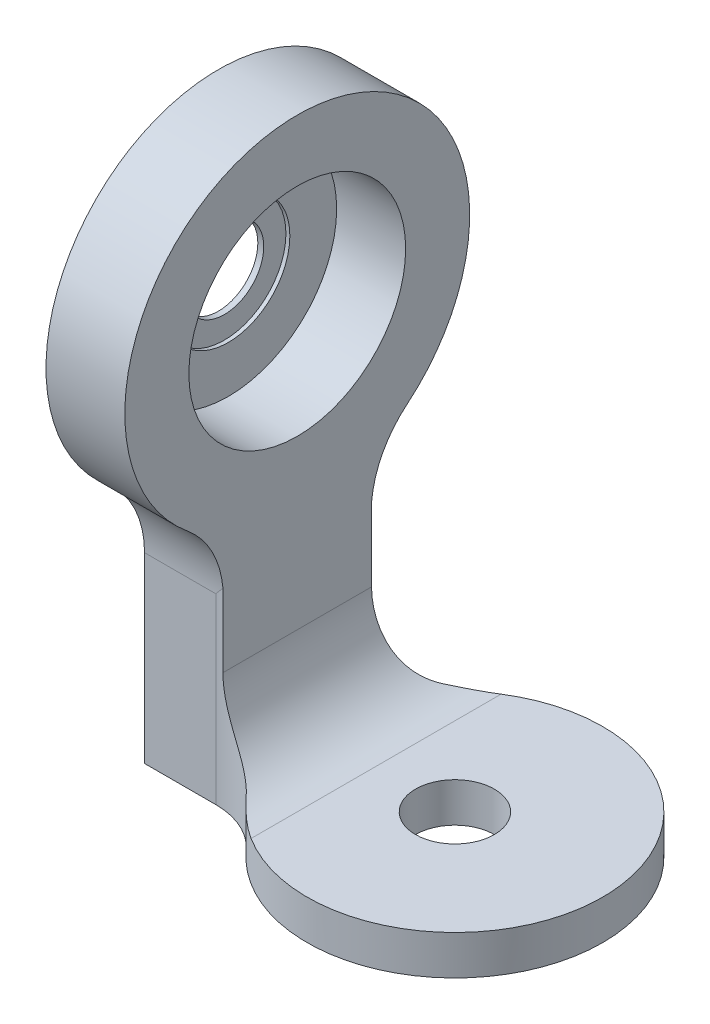
from build123d import *

# Parameters (mm, degrees)
EXTRUDE_1_DEPTH     = 4
SKETCH_4_R          = 17.5
EXTRUDE_2_DEPTH     = 8
SKETCH_3_R          = 11
CUT_EXTRUDE_1_DEPTH = 7
FILLET_5_R          = 7.5
FILLET_6_R          = 10
FILLET_7_R          = 8
SKETCH_5_R          = 4
CUT_EXTRUDE_2_DEPTH = 71.900963896
SKETCH_6_R          = 6.25
CUT_EXTRUDE_3_DEPTH = 0.4


with BuildPart() as part:
    # 草圖1 → 填料-伸長1 (new body)
    with BuildSketch(Plane(origin=(0, 0, 0), x_dir=(1, 0, 0), z_dir=(0, 1, 0))):
        with BuildLine():
            Line((-24, -7.5), (-12.990381057, -7.5))
            ThreePointArc((-12.990381057, -7.5), (-14.488887394, -3.882285677), (-15, 0))
            Line((-15, 0), (-24, 0))
            Line((-24, 0), (-24, -7.5))
        make_face()
        with BuildLine():
            ThreePointArc((-15, 0), (-14.488887394, 3.882285677), (-12.990381057, 7.5))
            Line((-12.990381057, 7.5), (-24, 7.5))
            Line((-24, 7.5), (-24, 0))
            Line((-24, 0), (-15, 0))
        make_face()
        with BuildLine():
            ThreePointArc((-4, 0), (0, 4), (4, 0))
            Line((4, 0), (15, 0))
            ThreePointArc((15, 0), (3.882285677, 14.488887394), (-12.990381057, 7.5))
            ThreePointArc((-12.990381057, 7.5), (-14.488887394, 3.882285677), (-15, 0))
            Line((-15, 0), (-4, 0))
        make_face()
        with BuildLine():
            Line((15, 0), (4, 0))
            ThreePointArc((4, 0), (0, -4), (-4, 0))
            Line((-4, 0), (-15, 0))
            ThreePointArc((-15, 0), (-14.488887394, -3.882285677), (-12.990381057, -7.5))
            ThreePointArc((-12.990381057, -7.5), (3.882285677, -14.488887394), (15, 0))
        make_face()
    extrude(amount=EXTRUDE_1_DEPTH)

    # 草圖4 → 填料-伸長2 (add)
    with BuildSketch(Plane.ZY.offset(24)):
        with Locations((0, 39.742437699)):
            Circle(SKETCH_4_R)
        with BuildLine():
            ThreePointArc((7.5, 23.931049399), (0, 22.242437699), (-7.5, 23.931049399))
            Line((-7.5, 23.931049399), (-7.5, 4))
            Line((-7.5, 4), (7.5, 4))
            Line((7.5, 4), (7.5, 23.931049399))
        make_face()
    extrude(amount=-EXTRUDE_2_DEPTH)

    # 草圖3 → 除料-伸長1 (cut)
    with BuildSketch(Plane.ZY.offset(16)):
        with Locations((0, 40)):
            Circle(SKETCH_3_R)
    extrude(amount=CUT_EXTRUDE_1_DEPTH, mode=Mode.SUBTRACT)

    # 圓角5
    fillet_5_edges = [part.edges().sort_by_distance(p)[0] for p in [
        (-12.990381057, 2, -7.5),
    ]]
    fillet(fillet_5_edges, radius=FILLET_5_R)
    fillet_5_2_edges = [part.edges().sort_by_distance(p)[0] for p in [
        (-12.990381057, 2, 7.5),
    ]]
    fillet(fillet_5_2_edges, radius=FILLET_5_R)

    # 圓角6
    # the kernel refuses this fillet: 10 mm, written as the material it adds along each edge
    with BuildSketch(Plane(origin=(-24, 23.931049399, -7.5), x_dir=(0, -1, 0), z_dir=(1, 0, 0))) as fillet_6_piece_1_section:
        with BuildLine():
            CenterArc((5.401815135, 10), FILLET_6_R, 219.521196359, 50.478803641)
            ThreePointArc((-2.312077024, 3.636363636), (-1.04368494, 1.889618599), (0, 0))
            Line((0, 0), (5.401815135, 0))
        make_face()
    fillet_6_piece_1 = extrude(amount=20.734028006, mode=Mode.PRIVATE)
    fillet_6_piece_1 = split(fillet_6_piece_1, bisect_by=Plane(origin=(-16, 22.860103081, -8.083386196), z_dir=(-1, 0, 0)), keep=Keep.TOP, mode=Mode.PRIVATE)
    add(fillet_6_piece_1)
    with BuildSketch(Plane(origin=(-24, 23.931049399, 7.5), x_dir=(0, -1, 0), z_dir=(1, 0, 0))) as fillet_6_piece_2_section:
        with BuildLine():
            CenterArc((5.401815135, -10), FILLET_6_R, 90, 50.478803641)
            ThreePointArc((-2.312077024, -3.636363636), (-1.04368494, -1.889618599), (0, 0))
            Line((0, 0), (5.401815135, 0))
        make_face()
    fillet_6_piece_2 = extrude(amount=20.734028006, mode=Mode.PRIVATE)
    fillet_6_piece_2 = split(fillet_6_piece_2, bisect_by=Plane(origin=(-16, 22.860102946, 8.083386188), z_dir=(-1, 0, 0)), keep=Keep.TOP, mode=Mode.PRIVATE)
    add(fillet_6_piece_2)

    # 圓角7
    fillet_7_edges = [part.edges().sort_by_distance(p)[0] for p in [
        (-16, 4, 0),
    ]]
    fillet(fillet_7_edges, radius=FILLET_7_R)

    # 草圖5 → 除料-伸長2 (cut, through all)
    with BuildSketch(Plane(origin=(-23, 0, 0), x_dir=(0, 0, -1), z_dir=(1, 0, 0))):
        with Locations((0, 40)):
            Circle(SKETCH_5_R)
    extrude(amount=-CUT_EXTRUDE_2_DEPTH, mode=Mode.SUBTRACT)

    # 草圖6 → 除料-伸長3 (cut)
    with BuildSketch(Plane(origin=(-23, 0, 0), x_dir=(0, 0, -1), z_dir=(1, 0, 0))):
        with Locations((0, 40)):
            Circle(SKETCH_6_R)
    extrude(amount=-CUT_EXTRUDE_3_DEPTH, mode=Mode.SUBTRACT)


solid = part.part
